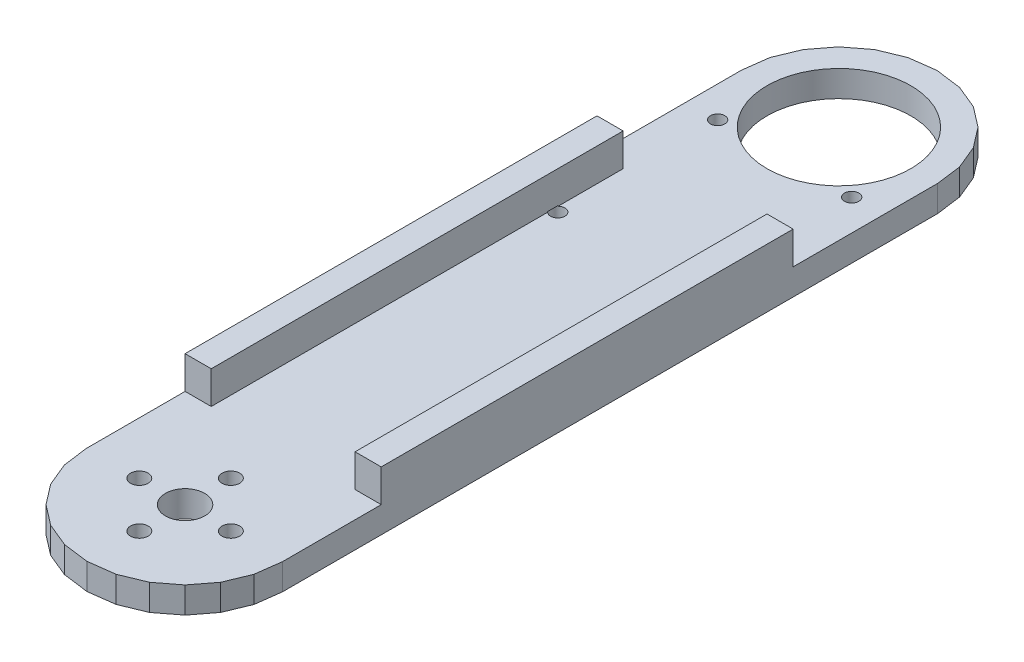
from build123d import *

# Parameters (mm, degrees)
BOSS_1_DEPTH  = 4
S_BOX2_W      = 4
S_BOX2_H      = 5.5
BOSS_2_DEPTH  = 63
S_BOX3_W      = 4
S_BOX3_H      = 5.5
BOSS_3_DEPTH  = 63
S_HOLE4_R     = 3
HOLE_4_DEPTH  = 4.2
S_HOLE5_R     = 1.35
HOLE_5_DEPTH  = 4.2
S_HOLE6_R     = 1.35
HOLE_6_DEPTH  = 4.2
S_HOLE7_R     = 1.35
HOLE_7_DEPTH  = 4.2
S_HOLE8_R     = 1.35
HOLE_8_DEPTH  = 4.2
S_HOLE9_R     = 11
HOLE_9_DEPTH  = 4.2
S_HOLE10_R    = 1.1
HOLE_10_DEPTH = 4.2
S_HOLE11_R    = 1.1
HOLE_11_DEPTH = 4.2
S_HOLE12_R    = 1.1
HOLE_12_DEPTH = 4.2
S_HOLE13_R    = 1.1
HOLE_13_DEPTH = 4.2


with BuildPart() as part:
    # S_prism1 → Boss_1 (new body)
    with BuildSketch(Plane(origin=(0, 16, 0), x_dir=(1, 0, 0), z_dir=(0, 1, 0))):
        Polygon((-15, -0.1), (-14.492, -3.956), (-13.004, -7.55), (-10.636, -10.636), (-7.55, -13.004), (-3.956, -14.492), (-0.1, -15), (0.1, -15), (3.956, -14.492), (7.55, -13.004), (10.636, -10.636), (13.004, -7.55), (14.492, -3.956), (15, -0.1), (15, 100.1), (14.492, 103.956), (13.004, 107.55), (10.636, 110.636), (7.55, 113.004), (3.956, 114.492), (0.1, 115), (-0.1, 115), (-3.956, 114.492), (-7.55, 113.004), (-10.636, 110.636), (-13.004, 107.55), (-14.492, 103.956), (-15, 100.1), align=None)
    extrude(amount=BOSS_1_DEPTH)

    # S_box2 → Boss_2 (add)
    with BuildSketch(Plane.XY.offset(-78)):
        with Locations((-13, 22.25)):
            Rectangle(S_BOX2_W, S_BOX2_H)
    extrude(amount=BOSS_2_DEPTH)

    # S_box3 → Boss_3 (add)
    with BuildSketch(Plane.XY.offset(-78)):
        with Locations((13, 22.25)):
            Rectangle(S_BOX3_W, S_BOX3_H)
    extrude(amount=BOSS_3_DEPTH)

    # S_hole4 → Hole_4 (cut)
    with BuildSketch(Plane(origin=(0, 15.9, 0), x_dir=(1, 0, 0), z_dir=(0, 1, 0))):
        Circle(S_HOLE4_R)
    extrude(amount=HOLE_4_DEPTH, mode=Mode.SUBTRACT)

    # S_hole5 → Hole_5 (cut)
    with BuildSketch(Plane(origin=(0, 15.9, 0), x_dir=(1, 0, 0), z_dir=(0, 1, 0))):
        with Locations((7, 0)):
            Circle(S_HOLE5_R)
    extrude(amount=HOLE_5_DEPTH, mode=Mode.SUBTRACT)

    # S_hole6 → Hole_6 (cut)
    with BuildSketch(Plane(origin=(0, 15.9, 0), x_dir=(1, 0, 0), z_dir=(0, 1, 0))):
        with Locations((0, -7)):
            Circle(S_HOLE6_R)
    extrude(amount=HOLE_6_DEPTH, mode=Mode.SUBTRACT)

    # S_hole7 → Hole_7 (cut)
    with BuildSketch(Plane(origin=(0, 15.9, 0), x_dir=(1, 0, 0), z_dir=(0, 1, 0))):
        with Locations((-7, 0)):
            Circle(S_HOLE7_R)
    extrude(amount=HOLE_7_DEPTH, mode=Mode.SUBTRACT)

    # S_hole8 → Hole_8 (cut)
    with BuildSketch(Plane(origin=(0, 15.9, 0), x_dir=(1, 0, 0), z_dir=(0, 1, 0))):
        with Locations((0, 7)):
            Circle(S_HOLE8_R)
    extrude(amount=HOLE_8_DEPTH, mode=Mode.SUBTRACT)

    # S_hole9 → Hole_9 (cut)
    with BuildSketch(Plane(origin=(0, 15.9, 0), x_dir=(1, 0, 0), z_dir=(0, 1, 0))):
        with Locations((0, 100)):
            Circle(S_HOLE9_R)
    extrude(amount=HOLE_9_DEPTH, mode=Mode.SUBTRACT)

    # S_hole10 → Hole_10 (cut)
    with BuildSketch(Plane(origin=(0, 15.9, 0), x_dir=(1, 0, 0), z_dir=(0, 1, 0))):
        with Locations((-10.25, 91.7)):
            Circle(S_HOLE10_R)
    extrude(amount=HOLE_10_DEPTH, mode=Mode.SUBTRACT)

    # S_hole11 → Hole_11 (cut)
    with BuildSketch(Plane(origin=(0, 15.9, 0), x_dir=(1, 0, 0), z_dir=(0, 1, 0))):
        with Locations((10.25, 91.7)):
            Circle(S_HOLE11_R)
    extrude(amount=HOLE_11_DEPTH, mode=Mode.SUBTRACT)

    # S_hole12 → Hole_12 (cut)
    with BuildSketch(Plane(origin=(0, 15.9, 0), x_dir=(1, 0, 0), z_dir=(0, 1, 0))):
        with Locations((-10.25, 67.25)):
            Circle(S_HOLE12_R)
    extrude(amount=HOLE_12_DEPTH, mode=Mode.SUBTRACT)

    # S_hole13 → Hole_13 (cut)
    with BuildSketch(Plane(origin=(0, 15.9, 0), x_dir=(1, 0, 0), z_dir=(0, 1, 0))):
        with Locations((10.25, 67.25)):
            Circle(S_HOLE13_R)
    extrude(amount=HOLE_13_DEPTH, mode=Mode.SUBTRACT)


solid = part.part
